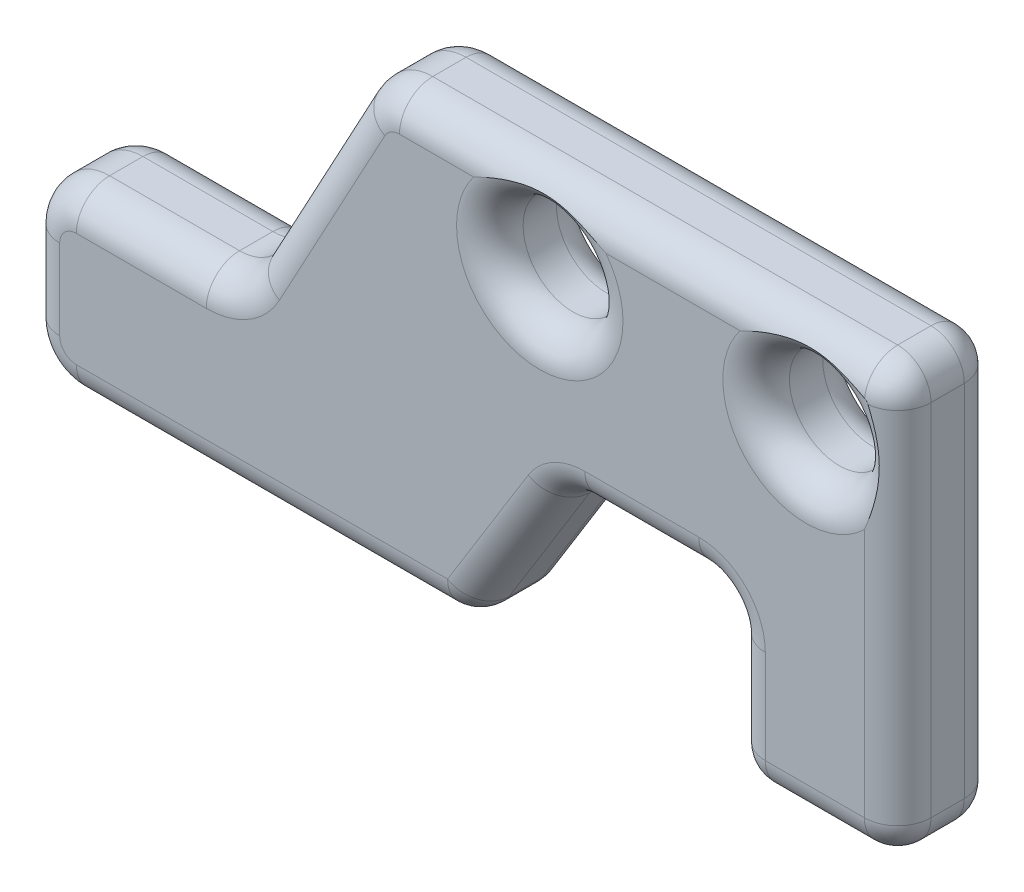
from build123d import *

# Parameters (mm, degrees)
SKETCH1_R           = 1.5
BOSS_EXTRUDE1_DEPTH = 3
FILLET1_R           = 1


with BuildPart() as part:
    # Sketch1 → Boss-Extrude1 (new body)
    with BuildSketch(Plane.XY):
        with BuildLine():
            Line((15.834228158, -6.224686262), (30.801713335, -6.224686262))
            Line((30.801713335, -6.224686262), (30.801713335, -19.027324957))
            Line((30.801713335, -19.027324957), (25.824879418, -19.027324957))
            Line((25.824879418, -19.027324957), (25.824879418, -14.212197487))
            Line((25.824879418, -14.212197487), (20.8480455, -14.212197487))
            Line((20.8480455, -14.212197487), (17.837626699, -19.075181704))
            Line((17.837626699, -19.075181704), (6.127112784, -19.075181704))
            ThreePointArc((6.127112784, -19.075181704), (5.066452612, -18.635841876), (4.627112784, -17.575181704))
            Line((4.627112784, -17.575181704), (4.627112784, -15.15921594))
            ThreePointArc((4.627112784, -15.15921594), (5.066452612, -14.098555769), (6.127112784, -13.65921594))
            Line((6.127112784, -13.65921594), (10.029789066, -13.65921594))
            ThreePointArc((10.029789066, -13.65921594), (10.798172809, -13.447465304), (11.349615557, -12.871997838))
            Line((11.349615557, -12.871997838), (14.514401667, -7.011904364))
            ThreePointArc((14.514401667, -7.011904364), (15.065844415, -6.436436898), (15.834228158, -6.224686262))
        make_face()
        with Locations((20.049294378, -8.743824417)):
            Circle(SKETCH1_R, mode=Mode.SUBTRACT)
        with Locations((28.049294378, -8.743824417)):
            Circle(SKETCH1_R, mode=Mode.SUBTRACT)
    extrude(amount=BOSS_EXTRUDE1_DEPTH)

    # Fillet1
    # the kernel refuses this fillet: 1 mm, written as the material it adds along each edge
    with BuildSketch(Plane(origin=(25.824879418, -14.212197487, 0), x_dir=(0, -1, 0), z_dir=(0, 0, 1))) as fillet1_piece_1:
        with BuildLine():
            CenterArc((FILLET1_R, -FILLET1_R), FILLET1_R, 90, 90)
            Line((0, -FILLET1_R), (0, 0))
            Line((0, 0), (FILLET1_R, 0))
        make_face()
    extrude(amount=3)
    with BuildSketch(Plane(origin=(20.8480455, -14.212197487, 0), x_dir=(1, 0, 0), z_dir=(0, 0, 1))) as fillet1_piece_2:
        with BuildLine():
            CenterArc((FILLET1_R * 0.557056098593, -FILLET1_R), FILLET1_R, 90, 58.240519915)
            Line((-FILLET1_R * 0.293209048095, -FILLET1_R * 0.473645385384), (0, 0))
            Line((0, 0), (FILLET1_R * 0.557056098593, 0))
        make_face()
    extrude(amount=3)
    # the kernel refuses this fillet: 1 mm, written as the material it takes off along each edge
    with BuildSketch(Plane(origin=(29.801713335, -18.027324957, 1), x_dir=(1, 0, 0), z_dir=(0, -1, 0))) as fillet1_2_piece_1_section:
        Polygon((0, 0), (FILLET1_R, 0), (FILLET1_R, -FILLET1_R), (0, -FILLET1_R), align=None)
    fillet1_2_piece_1 = extrude(amount=FILLET1_R, mode=Mode.PRIVATE)
    fillet1_2_piece_1 = fillet1_2_piece_1 - Plane(origin=(29.801713335, -18.027324957, 1), x_dir=(-0.7071067811865475, 0, 0.7071067811865475), z_dir=(0, -1, 0)) * Sphere(FILLET1_R, mode=Mode.PRIVATE)
    add(fillet1_2_piece_1, mode=Mode.SUBTRACT)
    with BuildSketch(Plane(origin=(26.824879418, -18.027324957, 1), x_dir=(0, 0, -1), z_dir=(0, -1, 0))) as fillet1_2_piece_2_section:
        Polygon((0, 0), (FILLET1_R, 0), (FILLET1_R, -FILLET1_R), (0, -FILLET1_R), align=None)
    fillet1_2_piece_2 = extrude(amount=FILLET1_R, mode=Mode.PRIVATE)
    fillet1_2_piece_2 = fillet1_2_piece_2 - Plane(origin=(26.824879418, -18.027324957, 1), x_dir=(0.7071067811865475, 0, 0.7071067811865475), z_dir=(0, -1, 0)) * Sphere(FILLET1_R, mode=Mode.PRIVATE)
    add(fillet1_2_piece_2, mode=Mode.SUBTRACT)
    with BuildSketch(Plane(origin=(17.280570601, -18.075181704, 1), x_dir=(0.8502651466878635, -0.5263546146162928, 0), z_dir=(0, 0, -1))) as fillet1_2_piece_3_section:
        Polygon((0, 0), (FILLET1_R, 0), (FILLET1_R, FILLET1_R * 0.557056098593), (FILLET1_R * 0.526354614616, FILLET1_R * 0.850265146688), align=None)
    fillet1_2_piece_3 = extrude(amount=FILLET1_R, mode=Mode.PRIVATE)
    fillet1_2_piece_3 = fillet1_2_piece_3 - Plane(origin=(17.280570601, -18.075181704, 1), x_dir=(-0.48664431846252326, 0.8736001987798231, 0), z_dir=(0, 0, -1)) * Sphere(FILLET1_R, mode=Mode.PRIVATE)
    add(fillet1_2_piece_3, mode=Mode.SUBTRACT)
    with BuildSketch(Plane(origin=(29.801713335, -7.224686262, 1), x_dir=(1, 0, 0), z_dir=(0, 1, 0))) as fillet1_2_piece_4_section:
        Polygon((0, 0), (FILLET1_R, 0), (FILLET1_R, FILLET1_R), (0, FILLET1_R), align=None)
    fillet1_2_piece_4 = extrude(amount=FILLET1_R, mode=Mode.PRIVATE)
    fillet1_2_piece_4 = fillet1_2_piece_4 - Plane(origin=(29.801713335, -7.224686262, 1), x_dir=(-0.7071067811865475, 0, 0.7071067811865475), z_dir=(0, 1, 0)) * Sphere(FILLET1_R, mode=Mode.PRIVATE)
    add(fillet1_2_piece_4, mode=Mode.SUBTRACT)
    with BuildSketch(Plane(origin=(29.801713335, -18.027324957, 2), x_dir=(0, -1, 0), z_dir=(1, 0, 0))) as fillet1_2_piece_5_section:
        Polygon((0, 0), (FILLET1_R, 0), (FILLET1_R, -FILLET1_R), (0, -FILLET1_R), align=None)
    fillet1_2_piece_5 = extrude(amount=FILLET1_R, mode=Mode.PRIVATE)
    fillet1_2_piece_5 = fillet1_2_piece_5 - Plane(origin=(29.801713335, -18.027324957, 2), x_dir=(0, 0.7071067811865475, -0.7071067811865475), z_dir=(1, 0, 0)) * Sphere(FILLET1_R, mode=Mode.PRIVATE)
    add(fillet1_2_piece_5, mode=Mode.SUBTRACT)
    with BuildSketch(Plane(origin=(26.824879418, -18.027324957, 2), x_dir=(-1, 0, 0), z_dir=(0, -1, 0))) as fillet1_2_piece_6_section:
        Polygon((0, 0), (FILLET1_R, 0), (FILLET1_R, -FILLET1_R), (0, -FILLET1_R), align=None)
    fillet1_2_piece_6 = extrude(amount=FILLET1_R, mode=Mode.PRIVATE)
    fillet1_2_piece_6 = fillet1_2_piece_6 - Plane(origin=(26.824879418, -18.027324957, 2), x_dir=(0.7071067811865475, 0, -0.7071067811865475), z_dir=(0, -1, 0)) * Sphere(FILLET1_R, mode=Mode.PRIVATE)
    add(fillet1_2_piece_6, mode=Mode.SUBTRACT)
    with BuildSketch(Plane(origin=(17.280570601, -18.075181704, 2), x_dir=(0.8502651466878635, -0.5263546146162928, 0), z_dir=(0, 0, 1))) as fillet1_2_piece_7_section:
        Polygon((0, 0), (FILLET1_R, 0), (FILLET1_R, -FILLET1_R * 0.557056098593), (FILLET1_R * 0.526354614616, -FILLET1_R * 0.850265146688), align=None)
    fillet1_2_piece_7 = extrude(amount=FILLET1_R, mode=Mode.PRIVATE)
    fillet1_2_piece_7 = fillet1_2_piece_7 - Plane(origin=(17.280570601, -18.075181704, 2), x_dir=(-0.48664431846252326, 0.8736001987798231, 0), z_dir=(0, 0, 1)) * Sphere(FILLET1_R, mode=Mode.PRIVATE)
    add(fillet1_2_piece_7, mode=Mode.SUBTRACT)
    with BuildSketch(Plane(origin=(29.801713335, -7.224686262, 2), x_dir=(1, 0, 0), z_dir=(0, 1, 0))) as fillet1_2_piece_8_section:
        Polygon((0, 0), (FILLET1_R, 0), (FILLET1_R, -FILLET1_R), (0, -FILLET1_R), align=None)
    fillet1_2_piece_8 = extrude(amount=FILLET1_R, mode=Mode.PRIVATE)
    fillet1_2_piece_8 = fillet1_2_piece_8 - Plane(origin=(29.801713335, -7.224686262, 2), x_dir=(-0.7071067811865475, 0, -0.7071067811865475), z_dir=(0, 1, 0)) * Sphere(FILLET1_R, mode=Mode.PRIVATE)
    add(fillet1_2_piece_8, mode=Mode.SUBTRACT)
    with BuildSketch(Plane(origin=(15.834228158, -7.724686262, 3), x_dir=(-0.8798843273453182, 0.47518793176182095, 0), z_dir=(-0.47518793176182095, -0.8798843273453182, 0))) as fillet1_2_piece_9:
        with BuildLine():
            CenterArc((1.5 - FILLET1_R, FILLET1_R), FILLET1_R, 270, 90)
            Line((1.5, FILLET1_R), (1.5, 0))
            Line((1.5, 0), (1.5 - FILLET1_R, 0))
        make_face()
    revolve(axis=Axis((15.834228158, -7.724686262, 3), (0, 0, -1)), revolution_arc=61.62841305, mode=Mode.SUBTRACT)
    with BuildSketch(Plane(origin=(29.801713335, -19.027324957, 0), x_dir=(0, 1, 0), z_dir=(-1, 0, 0))) as fillet1_2_piece_10:
        with BuildLine():
            CenterArc((FILLET1_R, -FILLET1_R), FILLET1_R, 90, 90)
            Line((0, -FILLET1_R), (0, 0))
            Line((0, 0), (FILLET1_R, 0))
        make_face()
    extrude(amount=2.976833917, mode=Mode.SUBTRACT)
    with BuildSketch(Plane(origin=(25.824879418, -18.027324957, 0), x_dir=(1, 0, 0), z_dir=(0, 1, 0))) as fillet1_2_piece_11:
        with BuildLine():
            CenterArc((FILLET1_R, -FILLET1_R), FILLET1_R, 90, 90)
            Line((0, -FILLET1_R), (0, 0))
            Line((0, 0), (FILLET1_R, 0))
        make_face()
    extrude(amount=2.815127471, mode=Mode.SUBTRACT)
    with BuildSketch(Plane(origin=(24.824879418, -14.212197487, 0), x_dir=(0, 1, 0), z_dir=(-1, 0, 0))) as fillet1_2_piece_12:
        with BuildLine():
            CenterArc((FILLET1_R, -FILLET1_R), FILLET1_R, 90, 90)
            Line((0, -FILLET1_R), (0, 0))
            Line((0, 0), (FILLET1_R, 0))
        make_face()
    extrude(amount=3.419777819, mode=Mode.SUBTRACT)
    with BuildSketch(Plane(origin=(20.554836452, -14.685842872, 0), x_dir=(-0.8502651466878635, 0.5263546146162928, 0), z_dir=(-0.5263546146162928, -0.8502651466878635, 0))) as fillet1_2_piece_13:
        with BuildLine():
            CenterArc((FILLET1_R, -FILLET1_R), FILLET1_R, 90, 90)
            Line((0, -FILLET1_R), (0, 0))
            Line((0, 0), (FILLET1_R, 0))
        make_face()
    extrude(amount=4.60526162, mode=Mode.SUBTRACT)
    with BuildSketch(Plane(origin=(17.280570601, -19.075181704, 0), x_dir=(0, 1, 0), z_dir=(-1, 0, 0))) as fillet1_2_piece_14:
        with BuildLine():
            CenterArc((FILLET1_R, -FILLET1_R), FILLET1_R, 90, 90)
            Line((0, -FILLET1_R), (0, 0))
            Line((0, 0), (FILLET1_R, 0))
        make_face()
    extrude(amount=11.153457816, mode=Mode.SUBTRACT)
    with BuildSketch(Plane(origin=(6.127112784, -17.575181704, 0), x_dir=(0, -1, 0), z_dir=(1, 0, 0))) as fillet1_2_piece_15:
        with BuildLine():
            CenterArc((1.5 - FILLET1_R, -FILLET1_R), FILLET1_R, 0, 90)
            Line((1.5, -FILLET1_R), (1.5, 0))
            Line((1.5, 0), (1.5 - FILLET1_R, 0))
        make_face()
    revolve(axis=Axis((6.127112784, -17.575181704, 0), (0, 0, -1)), revolution_arc=90, mode=Mode.SUBTRACT)
    with BuildSketch(Plane(origin=(4.627112784, -17.575181704, 0), x_dir=(0, 0, 1), z_dir=(0, 1, 0))) as fillet1_2_piece_16:
        with BuildLine():
            CenterArc((FILLET1_R, FILLET1_R), FILLET1_R, 180, 90)
            Line((0, FILLET1_R), (0, 0))
            Line((0, 0), (FILLET1_R, 0))
        make_face()
    extrude(amount=2.415965764, mode=Mode.SUBTRACT)
    with BuildSketch(Plane(origin=(6.127112784, -15.15921594, 0), x_dir=(-1, 0, 0), z_dir=(0, -1, 0))) as fillet1_2_piece_17:
        with BuildLine():
            CenterArc((1.5 - FILLET1_R, -FILLET1_R), FILLET1_R, 0, 90)
            Line((1.5 - FILLET1_R, 0), (1.5, 0))
            Line((1.5, 0), (1.5, -FILLET1_R))
        make_face()
    revolve(axis=Axis((6.127112784, -15.15921594, 0), (0, 0, -1)), revolution_arc=90, mode=Mode.SUBTRACT)
    with BuildSketch(Plane(origin=(11.349615557, -12.871997838, 3), x_dir=(0.8798843273453177, -0.4751879317618219, 0), z_dir=(0.4751879317618219, 0.8798843273453176, 0))) as fillet1_2_piece_18:
        with BuildLine():
            CenterArc((FILLET1_R, FILLET1_R), FILLET1_R, 180, 90)
            Line((0, FILLET1_R), (0, 0))
            Line((0, 0), (FILLET1_R, 0))
        make_face()
    extrude(amount=6.660072571, mode=Mode.SUBTRACT)
    with BuildSketch(Plane(origin=(6.127112784, -13.65921594, 0), x_dir=(0, 0, 1), z_dir=(1, 0, 0))) as fillet1_2_piece_19:
        with BuildLine():
            CenterArc((FILLET1_R, FILLET1_R), FILLET1_R, 180, 90)
            Line((0, FILLET1_R), (0, 0))
            Line((0, 0), (FILLET1_R, 0))
        make_face()
    extrude(amount=3.902676282, mode=Mode.SUBTRACT)
    with BuildSketch(Plane(origin=(10.029789066, -12.15921594, 0), x_dir=(0, -1, 0), z_dir=(-1, 0, 0))) as fillet1_2_piece_20:
        with BuildLine():
            CenterArc((1.5 + FILLET1_R, FILLET1_R), FILLET1_R, 180, 90)
            Line((1.5, FILLET1_R), (1.5, 0))
            Line((1.5, 0), (1.5 + FILLET1_R, 0))
        make_face()
    revolve(axis=Axis((10.029789066, -12.15921594, 0), (0, 0, 1)), revolution_arc=61.62841305, mode=Mode.SUBTRACT)
    with BuildSketch(Plane(origin=(11.349615557, -12.871997838, 0), x_dir=(0.8798843273453177, -0.4751879317618219, 0), z_dir=(0.4751879317618219, 0.8798843273453176, 0))) as fillet1_2_piece_21:
        with BuildLine():
            CenterArc((FILLET1_R, -FILLET1_R), FILLET1_R, 90, 90)
            Line((0, -FILLET1_R), (0, 0))
            Line((0, 0), (FILLET1_R, 0))
        make_face()
    extrude(amount=6.660072571, mode=Mode.SUBTRACT)
    with BuildSketch(Plane(origin=(15.834228158, -7.724686262, 0), x_dir=(-0.8798843273453182, 0.47518793176182095, 0), z_dir=(-0.47518793176182095, -0.8798843273453182, 0))) as fillet1_2_piece_22:
        with BuildLine():
            CenterArc((1.5 - FILLET1_R, -FILLET1_R), FILLET1_R, 0, 90)
            Line((1.5, -FILLET1_R), (1.5, 0))
            Line((1.5, 0), (1.5 - FILLET1_R, 0))
        make_face()
    revolve(axis=Axis((15.834228158, -7.724686262, 0), (0, 0, -1)), revolution_arc=61.62841305, mode=Mode.SUBTRACT)
    with BuildSketch(Plane(origin=(15.834228158, -6.224686262, 0), x_dir=(0, -1, 0), z_dir=(1, 0, 0))) as fillet1_2_piece_23:
        with BuildLine():
            CenterArc((FILLET1_R, -FILLET1_R), FILLET1_R, 90, 90)
            Line((0, -FILLET1_R), (0, 0))
            Line((0, 0), (FILLET1_R, 0))
        make_face()
    extrude(amount=13.967485176, mode=Mode.SUBTRACT)
    with BuildSketch(Plane(origin=(30.801713335, -7.224686262, 0), x_dir=(-1, 0, 0), z_dir=(0, -1, 0))) as fillet1_2_piece_24:
        with BuildLine():
            CenterArc((FILLET1_R, -FILLET1_R), FILLET1_R, 90, 90)
            Line((0, -FILLET1_R), (0, 0))
            Line((0, 0), (FILLET1_R, 0))
        make_face()
    extrude(amount=10.802638696, mode=Mode.SUBTRACT)
    with BuildSketch(Plane(origin=(10.029789066, -12.15921594, 3), x_dir=(0, -1, 0), z_dir=(-1, 0, 0))) as fillet1_2_piece_25:
        with BuildLine():
            CenterArc((1.5 + FILLET1_R, -FILLET1_R), FILLET1_R, 90, 90)
            Line((1.5, -FILLET1_R), (1.5, 0))
            Line((1.5, 0), (1.5 + FILLET1_R, 0))
        make_face()
    revolve(axis=Axis((10.029789066, -12.15921594, 3), (0, 0, 1)), revolution_arc=61.62841305, mode=Mode.SUBTRACT)
    with BuildSketch(Plane(origin=(30.801713335, -19.027324957, 1), x_dir=(0, 1, 0), z_dir=(0, 0, 1)), Plane(origin=(25.824879418, -19.027324957, 1), x_dir=(1, 0, 0), z_dir=(0, 0, 1)), Plane(origin=(30.801713335, -6.224686262, 1), x_dir=(-1, 0, 0), z_dir=(0, 0, 1))) as fillet1_2_piece_26:
        with BuildLine():
            CenterArc((FILLET1_R, FILLET1_R), FILLET1_R, 180, 90)
            Line((0, FILLET1_R), (0, 0))
            Line((0, 0), (FILLET1_R, 0))
        make_face()
    extrude(amount=1, mode=Mode.SUBTRACT)
    with BuildSketch(Plane(origin=(17.837626699, -19.075181704, 1), x_dir=(0.5263546146162922, 0.8502651466878639, 0), z_dir=(0, 0, 1))) as fillet1_2_piece_27:
        with BuildLine():
            CenterArc((FILLET1_R * 0.557056098593, FILLET1_R), FILLET1_R, 211.759480085, 58.240519915)
            Line((-FILLET1_R * 0.293209048095, FILLET1_R * 0.473645385384), (0, 0))
            Line((0, 0), (FILLET1_R * 0.557056098593, 0))
        make_face()
    extrude(amount=1, mode=Mode.SUBTRACT)
    with BuildSketch(Plane(origin=(6.127112784, -13.65921594, 3), x_dir=(0, 0, -1), z_dir=(1, 0, 0))) as fillet1_2_piece_28:
        with BuildLine():
            CenterArc((FILLET1_R, -FILLET1_R), FILLET1_R, 90, 90)
            Line((0, -FILLET1_R), (0, 0))
            Line((0, 0), (FILLET1_R, 0))
        make_face()
    extrude(amount=3.902676282, mode=Mode.SUBTRACT)
    with BuildSketch(Plane(origin=(6.127112784, -15.15921594, 3), x_dir=(-1, 0, 0), z_dir=(0, -1, 0))) as fillet1_2_piece_29:
        with BuildLine():
            CenterArc((1.5 - FILLET1_R, FILLET1_R), FILLET1_R, 270, 90)
            Line((1.5 - FILLET1_R, 0), (1.5, 0))
            Line((1.5, 0), (1.5, FILLET1_R))
        make_face()
    revolve(axis=Axis((6.127112784, -15.15921594, 3), (0, 0, -1)), revolution_arc=90, mode=Mode.SUBTRACT)
    with BuildSketch(Plane(origin=(4.627112784, -17.575181704, 3), x_dir=(0, 0, -1), z_dir=(0, 1, 0))) as fillet1_2_piece_30:
        with BuildLine():
            CenterArc((FILLET1_R, -FILLET1_R), FILLET1_R, 90, 90)
            Line((0, -FILLET1_R), (0, 0))
            Line((0, 0), (FILLET1_R, 0))
        make_face()
    extrude(amount=2.415965764, mode=Mode.SUBTRACT)
    with BuildSketch(Plane(origin=(20.049294378, -8.743824417, 0), x_dir=(1, 0, 0), z_dir=(0, -1, 0))) as fillet1_2_piece_31:
        with BuildLine():
            CenterArc((1.5 + FILLET1_R, FILLET1_R), FILLET1_R, 180, 90)
            Line((1.5, FILLET1_R), (1.5, 0))
            Line((1.5, 0), (1.5 + FILLET1_R, 0))
        make_face()
    revolve(axis=Axis((20.049294378, -8.743824417, 0), (0, 0, 1)), mode=Mode.SUBTRACT)
    with BuildSketch(Plane(origin=(20.049294378, -8.743824417, 3), x_dir=(1, 0, 0), z_dir=(0, -1, 0))) as fillet1_2_piece_32:
        with BuildLine():
            CenterArc((1.5 + FILLET1_R, -FILLET1_R), FILLET1_R, 90, 90)
            Line((1.5, -FILLET1_R), (1.5, 0))
            Line((1.5, 0), (1.5 + FILLET1_R, 0))
        make_face()
    revolve(axis=Axis((20.049294378, -8.743824417, 3), (0, 0, 1)), mode=Mode.SUBTRACT)
    with BuildSketch(Plane(origin=(6.127112784, -17.575181704, 3), x_dir=(0, -1, 0), z_dir=(1, 0, 0))) as fillet1_2_piece_33:
        with BuildLine():
            CenterArc((1.5 - FILLET1_R, FILLET1_R), FILLET1_R, 270, 90)
            Line((1.5, FILLET1_R), (1.5, 0))
            Line((1.5, 0), (1.5 - FILLET1_R, 0))
        make_face()
    revolve(axis=Axis((6.127112784, -17.575181704, 3), (0, 0, -1)), revolution_arc=90, mode=Mode.SUBTRACT)
    with BuildSketch(Plane(origin=(28.049294378, -8.743824417, 0), x_dir=(1, 0, 0), z_dir=(0, -1, 0))) as fillet1_2_piece_34:
        with BuildLine():
            CenterArc((1.5 + FILLET1_R, FILLET1_R), FILLET1_R, 180, 90)
            Line((1.5, FILLET1_R), (1.5, 0))
            Line((1.5, 0), (1.5 + FILLET1_R, 0))
        make_face()
    revolve(axis=Axis((28.049294378, -8.743824417, 0), (0, 0, 1)), mode=Mode.SUBTRACT)
    with BuildSketch(Plane(origin=(28.049294378, -8.743824417, 3), x_dir=(1, 0, 0), z_dir=(0, -1, 0))) as fillet1_2_piece_35:
        with BuildLine():
            CenterArc((1.5 + FILLET1_R, -FILLET1_R), FILLET1_R, 90, 90)
            Line((1.5, -FILLET1_R), (1.5, 0))
            Line((1.5, 0), (1.5 + FILLET1_R, 0))
        make_face()
    revolve(axis=Axis((28.049294378, -8.743824417, 3), (0, 0, 1)), mode=Mode.SUBTRACT)
    with BuildSketch(Plane(origin=(17.280570601, -19.075181704, 3), x_dir=(0, 1, 0), z_dir=(-1, 0, 0))) as fillet1_2_piece_36:
        with BuildLine():
            CenterArc((FILLET1_R, FILLET1_R), FILLET1_R, 180, 90)
            Line((0, FILLET1_R), (0, 0))
            Line((0, 0), (FILLET1_R, 0))
        make_face()
    extrude(amount=11.153457816, mode=Mode.SUBTRACT)
    with BuildSketch(Plane(origin=(20.554836452, -14.685842872, 3), x_dir=(-0.8502651466878635, 0.5263546146162928, 0), z_dir=(-0.5263546146162928, -0.8502651466878635, 0))) as fillet1_2_piece_37:
        with BuildLine():
            CenterArc((FILLET1_R, FILLET1_R), FILLET1_R, 180, 90)
            Line((0, FILLET1_R), (0, 0))
            Line((0, 0), (FILLET1_R, 0))
        make_face()
    extrude(amount=4.60526162, mode=Mode.SUBTRACT)
    with BuildSketch(Plane(origin=(24.824879418, -14.212197487, 3), x_dir=(0, 1, 0), z_dir=(-1, 0, 0))) as fillet1_2_piece_38:
        with BuildLine():
            CenterArc((FILLET1_R, FILLET1_R), FILLET1_R, 180, 90)
            Line((0, FILLET1_R), (0, 0))
            Line((0, 0), (FILLET1_R, 0))
        make_face()
    extrude(amount=3.419777819, mode=Mode.SUBTRACT)
    with BuildSketch(Plane(origin=(30.801713335, -7.224686262, 3), x_dir=(-1, 0, 0), z_dir=(0, -1, 0))) as fillet1_2_piece_39:
        with BuildLine():
            CenterArc((FILLET1_R, FILLET1_R), FILLET1_R, 180, 90)
            Line((0, FILLET1_R), (0, 0))
            Line((0, 0), (FILLET1_R, 0))
        make_face()
    extrude(amount=10.802638696, mode=Mode.SUBTRACT)
    with BuildSketch(Plane(origin=(25.824879418, -18.027324957, 3), x_dir=(1, 0, 0), z_dir=(0, 1, 0))) as fillet1_2_piece_40:
        with BuildLine():
            CenterArc((FILLET1_R, FILLET1_R), FILLET1_R, 180, 90)
            Line((0, FILLET1_R), (0, 0))
            Line((0, 0), (FILLET1_R, 0))
        make_face()
    extrude(amount=2.815127471, mode=Mode.SUBTRACT)
    with BuildSketch(Plane(origin=(29.801713335, -19.027324957, 3), x_dir=(0, 1, 0), z_dir=(-1, 0, 0))) as fillet1_2_piece_41:
        with BuildLine():
            CenterArc((FILLET1_R, FILLET1_R), FILLET1_R, 180, 90)
            Line((0, FILLET1_R), (0, 0))
            Line((0, 0), (FILLET1_R, 0))
        make_face()
    extrude(amount=2.976833917, mode=Mode.SUBTRACT)
    with BuildSketch(Plane(origin=(15.834228158, -6.224686262, 3), x_dir=(0, -1, 0), z_dir=(1, 0, 0))) as fillet1_2_piece_42:
        with BuildLine():
            CenterArc((FILLET1_R, FILLET1_R), FILLET1_R, 180, 90)
            Line((0, FILLET1_R), (0, 0))
            Line((0, 0), (FILLET1_R, 0))
        make_face()
    extrude(amount=13.967485176, mode=Mode.SUBTRACT)
    with BuildSketch(Plane(origin=(24.824879418, -15.212197487, 3), x_dir=(1, 0, 0), z_dir=(0, -1, 0))) as fillet1_2_piece_43:
        with BuildLine():
            CenterArc((1 + FILLET1_R, -FILLET1_R), FILLET1_R, 90, 90)
            Line((1, -FILLET1_R), (1, 0))
            Line((1, 0), (1 + FILLET1_R, 0))
        make_face()
    revolve(axis=Axis((24.824879418, -15.212197487, 3), (0, 0, 1)), revolution_arc=90, mode=Mode.SUBTRACT)
    with BuildSketch(Plane(origin=(21.405101599, -15.212197487, 3), x_dir=(0, 1, 0), z_dir=(1, 0, 0))) as fillet1_2_piece_44:
        with BuildLine():
            CenterArc((1 + FILLET1_R, -FILLET1_R), FILLET1_R, 90, 90)
            Line((1, -FILLET1_R), (1, 0))
            Line((1, 0), (1 + FILLET1_R, 0))
        make_face()
    revolve(axis=Axis((21.405101599, -15.212197487, 3), (0, 0, 1)), revolution_arc=58.240519915, mode=Mode.SUBTRACT)
    with BuildSketch(Plane(origin=(21.405101599, -15.212197487, 0), x_dir=(0, 1, 0), z_dir=(1, 0, 0))) as fillet1_2_piece_45:
        with BuildLine():
            CenterArc((1 + FILLET1_R, FILLET1_R), FILLET1_R, 180, 90)
            Line((1, FILLET1_R), (1, 0))
            Line((1, 0), (1 + FILLET1_R, 0))
        make_face()
    revolve(axis=Axis((21.405101599, -15.212197487, 0), (0, 0, 1)), revolution_arc=58.240519915, mode=Mode.SUBTRACT)
    with BuildSketch(Plane(origin=(24.824879418, -15.212197487, 0), x_dir=(1, 0, 0), z_dir=(0, -1, 0))) as fillet1_2_piece_46:
        with BuildLine():
            CenterArc((1 + FILLET1_R, FILLET1_R), FILLET1_R, 180, 90)
            Line((1, FILLET1_R), (1, 0))
            Line((1, 0), (1 + FILLET1_R, 0))
        make_face()
    revolve(axis=Axis((24.824879418, -15.212197487, 0), (0, 0, 1)), revolution_arc=90, mode=Mode.SUBTRACT)


solid = part.part
